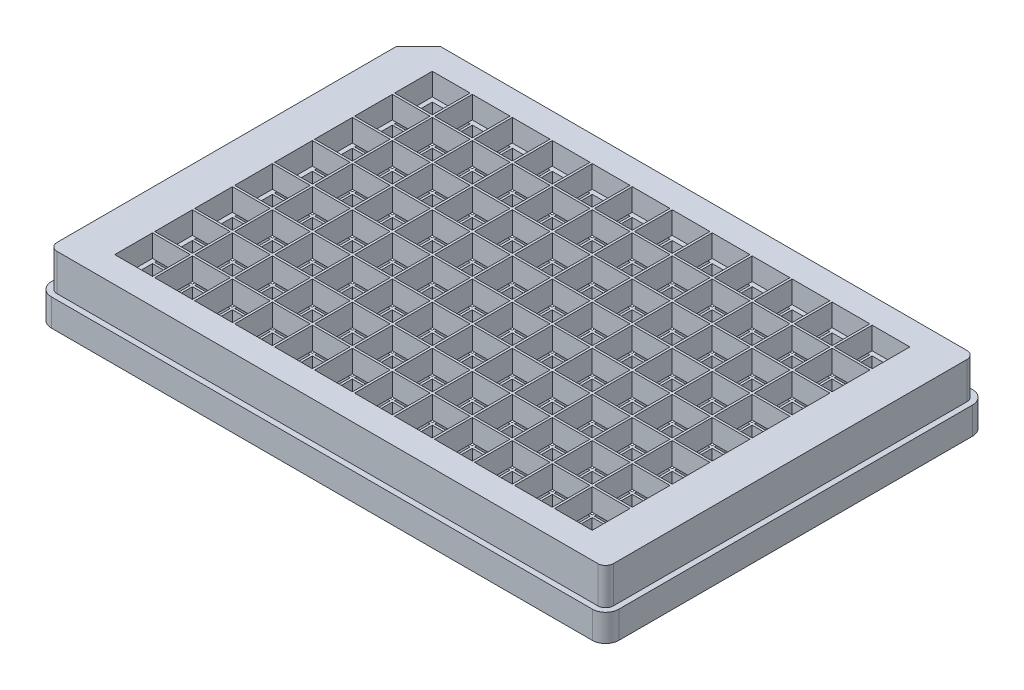
from build123d import *

# Parameters (mm, degrees)
SKETCH1_W           = 127.75
SKETCH1_H           = 85.6
BOSS_EXTRUDE1_DEPTH = 14.35
FILLET1_R           = 3
CUT_FLANGE_DEPTH    = 8.25
SKETCH5_W           = 80.1
SKETCH5_H           = 1
CUT_PAPERSLOT_DEPTH = 123.75
SHELL6_DEPTH        = 4.35
SHELL6_2_OUTLINE_W  = 119.75
SHELL6_2_OUTLINE_H  = 77.6
SHELL6_2_DEPTH      = 2.1
SKETCH4_W           = 8.5
SKETCH4_H           = 8.5
CUT_EXTRUDE2_DEPTH  = 10


# Read off the part's stored shape, not the designer's step: Shell6
with BuildPart() as part:
    # Sketch1 → Boss-Extrude1 (new body)
    with BuildSketch(Plane(origin=(0, 0, 0), x_dir=(1, 0, 0), z_dir=(0, 1, 0))):
        Rectangle(SKETCH1_W, SKETCH1_H)
    extrude(amount=BOSS_EXTRUDE1_DEPTH)

    # Fillet1
    fillet1_edges = [part.edges().sort_by_distance(p)[0] for p in [
        (-63.875, 7.175, -42.8),
        (63.875, 7.175, -42.8),
        (63.875, 7.175, 42.8),
        (-63.875, 7.175, 42.8),
    ]]
    fillet(fillet1_edges, radius=FILLET1_R)

    # Sketch3 → Cut-Flange (cut)
    with BuildSketch(Plane(origin=(0, 14.35, 0), x_dir=(1, 0, 0), z_dir=(0, 1, 0))):
        with BuildLine():
            Line((-63.875, 39.8), (-63.875, -39.8))
            ThreePointArc((-63.875, -39.8), (-62.996320344, -41.921320344), (-60.875, -42.8))
            Line((-60.875, -42.8), (60.875, -42.8))
            ThreePointArc((60.875, -42.8), (62.996320344, -41.921320344), (63.875, -39.8))
            Line((63.875, -39.8), (63.875, 39.8))
            ThreePointArc((63.875, 39.8), (62.996320344, 41.921320344), (60.875, 42.8))
            Line((60.875, 42.8), (-60.875, 42.8))
            ThreePointArc((-60.875, 42.8), (-62.996320344, 41.921320344), (-63.875, 39.8))
        make_face()
        with BuildLine():
            Line((-62.625, 36.600252532), (-62.625, -39.8))
            ThreePointArc((-62.625, -39.8), (-62.112436867, -41.037436867), (-60.875, -41.55))
            Line((-60.875, -41.55), (60.875, -41.55))
            ThreePointArc((60.875, -41.55), (62.112436867, -41.037436867), (62.625, -39.8))
            Line((62.625, -39.8), (62.625, 39.8))
            ThreePointArc((62.625, 39.8), (62.112436867, 41.037436867), (60.875, 41.55))
            Line((60.875, 41.55), (-57.675252532, 41.55))
            Line((-57.675252532, 41.55), (-62.625, 36.600252532))
        make_face(mode=Mode.SUBTRACT)
    extrude(amount=-CUT_FLANGE_DEPTH, mode=Mode.SUBTRACT)

    # Sketch5 → Cut-PaperSlot (cut)
    with BuildSketch(Plane.ZY.offset(62.625)):
        with Locations((0, 8.85)):
            Rectangle(SKETCH5_W, SKETCH5_H)
    extrude(amount=-CUT_PAPERSLOT_DEPTH, mode=Mode.SUBTRACT)

    # Shell6 outline → Shell6 (cut)
    with BuildSketch(Plane(origin=(0, 0, 0), x_dir=(1, 0, 0), z_dir=(0, 1, 0))):
        Polygon((-56.018398282, 37.55), (-58.625, 34.943398282), (-58.625, -37.55), (58.625, -37.55), (58.625, 37.55), align=None)
    extrude(amount=SHELL6_DEPTH, mode=Mode.SUBTRACT)

    # Shell6 2 outline → Shell6 2 (cut)
    with BuildSketch(Plane(origin=(0, 0, 0), x_dir=(1, 0, 0), z_dir=(0, 1, 0))):
        Rectangle(SHELL6_2_OUTLINE_W, SHELL6_2_OUTLINE_H)
        Polygon((-58.625, -37.55), (-58.625, 34.943398282), (-56.018398282, 37.55), (58.625, 37.55), (58.625, -37.55), align=None, mode=Mode.SUBTRACT)
    extrude(amount=SHELL6_2_DEPTH, mode=Mode.SUBTRACT)

    # Sketch4 → Cut-Extrude2 (cut)
    with BuildSketch(Plane(origin=(0, 14.35, 0), x_dir=(1, 0, 0), z_dir=(0, 1, 0))):
        with Locations((-40.495, 31.56)):
            Rectangle(SKETCH4_W, SKETCH4_H)
        with Locations((-49.495, 31.56)):
            Rectangle(SKETCH4_W, SKETCH4_H)
        with Locations((-31.495, 31.56)):
            Rectangle(SKETCH4_W, SKETCH4_H)
        with Locations((-22.495, 31.56)):
            Rectangle(SKETCH4_W, SKETCH4_H)
        with Locations((-13.495, 31.56)):
            Rectangle(SKETCH4_W, SKETCH4_H)
        with Locations((-4.495, 31.56)):
            Rectangle(SKETCH4_W, SKETCH4_H)
        with Locations((4.505, 31.56)):
            Rectangle(SKETCH4_W, SKETCH4_H)
        with Locations((13.505, 31.56)):
            Rectangle(SKETCH4_W, SKETCH4_H)
        with Locations((22.505, 31.56)):
            Rectangle(SKETCH4_W, SKETCH4_H)
        with Locations((31.505, 31.56)):
            Rectangle(SKETCH4_W, SKETCH4_H)
        with Locations((40.505, 31.56)):
            Rectangle(SKETCH4_W, SKETCH4_H)
        with Locations((49.505, 31.56)):
            Rectangle(SKETCH4_W, SKETCH4_H)
        with Locations((-40.495, 22.56)):
            Rectangle(SKETCH4_W, SKETCH4_H)
        with Locations((-31.495, 22.56)):
            Rectangle(SKETCH4_W, SKETCH4_H)
        with Locations((-22.495, 22.56)):
            Rectangle(SKETCH4_W, SKETCH4_H)
        with Locations((-13.495, 22.56)):
            Rectangle(SKETCH4_W, SKETCH4_H)
        with Locations((-4.495, 22.56)):
            Rectangle(SKETCH4_W, SKETCH4_H)
        with Locations((4.505, 22.56)):
            Rectangle(SKETCH4_W, SKETCH4_H)
        with Locations((13.505, 22.56)):
            Rectangle(SKETCH4_W, SKETCH4_H)
        with Locations((22.505, 22.56)):
            Rectangle(SKETCH4_W, SKETCH4_H)
        with Locations((31.505, 22.56)):
            Rectangle(SKETCH4_W, SKETCH4_H)
        with Locations((40.505, 22.56)):
            Rectangle(SKETCH4_W, SKETCH4_H)
        with Locations((49.505, 22.56)):
            Rectangle(SKETCH4_W, SKETCH4_H)
        with Locations((-40.495, 13.56)):
            Rectangle(SKETCH4_W, SKETCH4_H)
        with Locations((-31.495, 13.56)):
            Rectangle(SKETCH4_W, SKETCH4_H)
        with Locations((-22.495, 13.56)):
            Rectangle(SKETCH4_W, SKETCH4_H)
        with Locations((-13.495, 13.56)):
            Rectangle(SKETCH4_W, SKETCH4_H)
        with Locations((-4.495, 13.56)):
            Rectangle(SKETCH4_W, SKETCH4_H)
        with Locations((4.505, 13.56)):
            Rectangle(SKETCH4_W, SKETCH4_H)
        with Locations((13.505, 13.56)):
            Rectangle(SKETCH4_W, SKETCH4_H)
        with Locations((22.505, 13.56)):
            Rectangle(SKETCH4_W, SKETCH4_H)
        with Locations((31.505, 13.56)):
            Rectangle(SKETCH4_W, SKETCH4_H)
        with Locations((40.505, 13.56)):
            Rectangle(SKETCH4_W, SKETCH4_H)
        with Locations((49.505, 13.56)):
            Rectangle(SKETCH4_W, SKETCH4_H)
        with Locations((-40.495, 4.56)):
            Rectangle(SKETCH4_W, SKETCH4_H)
        with Locations((-31.495, 4.56)):
            Rectangle(SKETCH4_W, SKETCH4_H)
        with Locations((-22.495, 4.56)):
            Rectangle(SKETCH4_W, SKETCH4_H)
        with Locations((-13.495, 4.56)):
            Rectangle(SKETCH4_W, SKETCH4_H)
        with Locations((-4.495, 4.56)):
            Rectangle(SKETCH4_W, SKETCH4_H)
        with Locations((4.505, 4.56)):
            Rectangle(SKETCH4_W, SKETCH4_H)
        with Locations((13.505, 4.56)):
            Rectangle(SKETCH4_W, SKETCH4_H)
        with Locations((22.505, 4.56)):
            Rectangle(SKETCH4_W, SKETCH4_H)
        with Locations((31.505, 4.56)):
            Rectangle(SKETCH4_W, SKETCH4_H)
        with Locations((40.505, 4.56)):
            Rectangle(SKETCH4_W, SKETCH4_H)
        with Locations((49.505, 4.56)):
            Rectangle(SKETCH4_W, SKETCH4_H)
        with Locations((-40.495, -4.44)):
            Rectangle(SKETCH4_W, SKETCH4_H)
        with Locations((-31.495, -4.44)):
            Rectangle(SKETCH4_W, SKETCH4_H)
        with Locations((-22.495, -4.44)):
            Rectangle(SKETCH4_W, SKETCH4_H)
        with Locations((-13.495, -4.44)):
            Rectangle(SKETCH4_W, SKETCH4_H)
        with Locations((-4.495, -4.44)):
            Rectangle(SKETCH4_W, SKETCH4_H)
        with Locations((4.505, -4.44)):
            Rectangle(SKETCH4_W, SKETCH4_H)
        with Locations((13.505, -4.44)):
            Rectangle(SKETCH4_W, SKETCH4_H)
        with Locations((22.505, -4.44)):
            Rectangle(SKETCH4_W, SKETCH4_H)
        with Locations((31.505, -4.44)):
            Rectangle(SKETCH4_W, SKETCH4_H)
        with Locations((40.505, -4.44)):
            Rectangle(SKETCH4_W, SKETCH4_H)
        with Locations((49.505, -4.44)):
            Rectangle(SKETCH4_W, SKETCH4_H)
        with Locations((-40.495, -13.44)):
            Rectangle(SKETCH4_W, SKETCH4_H)
        with Locations((-31.495, -13.44)):
            Rectangle(SKETCH4_W, SKETCH4_H)
        with Locations((-22.495, -13.44)):
            Rectangle(SKETCH4_W, SKETCH4_H)
        with Locations((-13.495, -13.44)):
            Rectangle(SKETCH4_W, SKETCH4_H)
        with Locations((-4.495, -13.44)):
            Rectangle(SKETCH4_W, SKETCH4_H)
        with Locations((4.505, -13.44)):
            Rectangle(SKETCH4_W, SKETCH4_H)
        with Locations((13.505, -13.44)):
            Rectangle(SKETCH4_W, SKETCH4_H)
        with Locations((22.505, -13.44)):
            Rectangle(SKETCH4_W, SKETCH4_H)
        with Locations((31.505, -13.44)):
            Rectangle(SKETCH4_W, SKETCH4_H)
        with Locations((40.505, -13.44)):
            Rectangle(SKETCH4_W, SKETCH4_H)
        with Locations((49.505, -13.44)):
            Rectangle(SKETCH4_W, SKETCH4_H)
        with Locations((-40.495, -22.44)):
            Rectangle(SKETCH4_W, SKETCH4_H)
        with Locations((-31.495, -22.44)):
            Rectangle(SKETCH4_W, SKETCH4_H)
        with Locations((-22.495, -22.44)):
            Rectangle(SKETCH4_W, SKETCH4_H)
        with Locations((-13.495, -22.44)):
            Rectangle(SKETCH4_W, SKETCH4_H)
        with Locations((-4.495, -22.44)):
            Rectangle(SKETCH4_W, SKETCH4_H)
        with Locations((4.505, -22.44)):
            Rectangle(SKETCH4_W, SKETCH4_H)
        with Locations((13.505, -22.44)):
            Rectangle(SKETCH4_W, SKETCH4_H)
        with Locations((22.505, -22.44)):
            Rectangle(SKETCH4_W, SKETCH4_H)
        with Locations((31.505, -22.44)):
            Rectangle(SKETCH4_W, SKETCH4_H)
        with Locations((40.505, -22.44)):
            Rectangle(SKETCH4_W, SKETCH4_H)
        with Locations((49.505, -22.44)):
            Rectangle(SKETCH4_W, SKETCH4_H)
        with Locations((-40.495, -31.44)):
            Rectangle(SKETCH4_W, SKETCH4_H)
        with Locations((-31.495, -31.44)):
            Rectangle(SKETCH4_W, SKETCH4_H)
        with Locations((-22.495, -31.44)):
            Rectangle(SKETCH4_W, SKETCH4_H)
        with Locations((-13.495, -31.44)):
            Rectangle(SKETCH4_W, SKETCH4_H)
        with Locations((-4.495, -31.44)):
            Rectangle(SKETCH4_W, SKETCH4_H)
        with Locations((4.505, -31.44)):
            Rectangle(SKETCH4_W, SKETCH4_H)
        with Locations((13.505, -31.44)):
            Rectangle(SKETCH4_W, SKETCH4_H)
        with Locations((22.505, -31.44)):
            Rectangle(SKETCH4_W, SKETCH4_H)
        with Locations((31.505, -31.44)):
            Rectangle(SKETCH4_W, SKETCH4_H)
        with Locations((40.505, -31.44)):
            Rectangle(SKETCH4_W, SKETCH4_H)
        with Locations((49.505, -31.44)):
            Rectangle(SKETCH4_W, SKETCH4_H)
        with Locations((-49.495, 22.56)):
            Rectangle(SKETCH4_W, SKETCH4_H)
        with Locations((-49.495, 13.56)):
            Rectangle(SKETCH4_W, SKETCH4_H)
        with Locations((-49.495, 4.56)):
            Rectangle(SKETCH4_W, SKETCH4_H)
        with Locations((-49.495, -4.44)):
            Rectangle(SKETCH4_W, SKETCH4_H)
        with Locations((-49.495, -13.44)):
            Rectangle(SKETCH4_W, SKETCH4_H)
        with Locations((-49.495, -22.44)):
            Rectangle(SKETCH4_W, SKETCH4_H)
        with Locations((-49.495, -31.44)):
            Rectangle(SKETCH4_W, SKETCH4_H)
    extrude(amount=-CUT_EXTRUDE2_DEPTH, mode=Mode.SUBTRACT)


solid = part.part
